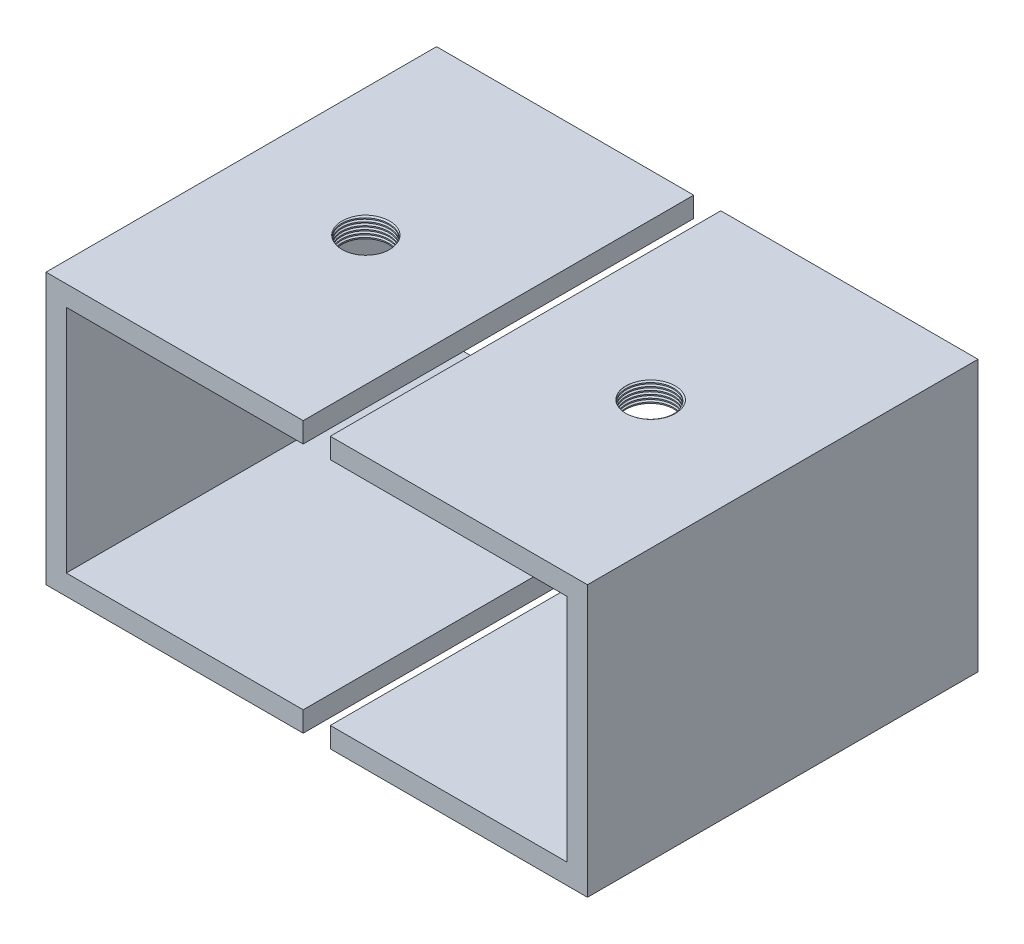
from build123d import *

# Parameters (mm, degrees)
BOSS_EXTRUDE1_DEPTH   = 288.5
BOSS_EXTRUDE1_2_DEPTH = 288.5
SKETCH2_R             = 17.5
CUT_EXTRUDE1_DEPTH    = 24
CUT_SWEEP1_PITCH      = 2.5


with BuildPart() as part:
    # Sketch1 → Boss-Extrude1 (new body)
    with BuildSketch(Plane.XY):
        Polygon((-199.740952381, -100.12952381), (-9.740952381, -100.12952381), (-9.740952381, -85.12952381), (-184.740952381, -85.12952381), (-184.740952381, 84.87047619), (-9.740952381, 84.87047619), (-9.740952381, 99.87047619), (-199.740952381, 99.87047619), align=None)
    extrude(amount=BOSS_EXTRUDE1_DEPTH)


with BuildPart() as body_2:
    # Sketch1 → Boss-Extrude1 2 (new body)
    with BuildSketch(Plane.XY):
        Polygon((10.259047619, -85.12952381), (10.259047619, -100.12952381), (200.259047619, -100.12952381), (200.259047619, 99.87047619), (10.259047619, 99.87047619), (10.259047619, 84.87047619), (185.259047619, 84.87047619), (185.259047619, -85.12952381), align=None)
    extrude(amount=BOSS_EXTRUDE1_2_DEPTH)


with BuildPart() as cut_extrude1_tool:
    # Sketch2 → Cut-Extrude1 (new body)
    with BuildSketch(Plane(origin=(0, 99.87047619, 0), x_dir=(1, 0, 0), z_dir=(0, 1, 0))):
        with Locations(Location((-104.740952381, -147.219115945, 0), (0, 0, 270))):
            Circle(SKETCH2_R)
        with Locations(Location((104.740952381, -147.219115945, 0), (0, 0, 90))):
            Circle(SKETCH2_R)
    cut_extrude1 = extrude(amount=-CUT_EXTRUDE1_DEPTH)


with BuildPart() as part_1:
    add(part.part)

    # Cut-Extrude1: cut by cut_extrude1_tool
    add(cut_extrude1_tool.part, mode=Mode.SUBTRACT)

    # Cut-Sweep1: arcs per turn and ends read off the stored shape
    # Cut-Sweep1: the profile of Sketch4 screwed along a right-hand helix through 7.6 turns, 10 arcs to a turn; built about Z, then put on its axis
    cut_sweep1_z = Axis((0, 0, 0), (0, 0, 1))
    cut_sweep1_corners = [(16.765090832, -0.0274724, -1.291700734), (18.914142879, -0.000730656, -2.467864065), (16.820766289, 0.028203056, -3.7404352)]
    with BuildLine(mode=Mode.PRIVATE) as cut_sweep1_profile:
        Line(cut_sweep1_corners[0], cut_sweep1_corners[1])
        Line(cut_sweep1_corners[1], cut_sweep1_corners[2])
        Line(cut_sweep1_corners[2], cut_sweep1_corners[0])
    cut_sweep1_cap = Face(cut_sweep1_profile.wire())
    cut_sweep1_turn_angles = [0, 18, 36, 54, 72, 90, 108, 126, 144, 162, 180, 198, 216, 234, 252, 270, 288, 306, 324, 342, 360]
    cut_sweep1_turn_weights = [1, 0.9510565162951535, 1, 0.9510565162951535, 1, 0.9510565162951535, 1, 0.9510565162951535, 1, 0.9510565162951535, 1, 0.9510565162951535, 1, 0.9510565162951535, 1, 0.9510565162951535, 1, 0.9510565162951535, 1, 0.9510565162951535, 1]
    cut_sweep1_turn_rails = [Edge.make_bspline([Vector(p[0], p[1], 0).rotate(cut_sweep1_z, cut_sweep1_turn_angles[k]) / cut_sweep1_turn_weights[k] + Vector(0, 0, p[2] + CUT_SWEEP1_PITCH * cut_sweep1_turn_angles[k] / 360) for k in range(21)], [0, 0, 0, 1, 1, 2, 2, 3, 3, 4, 4, 5, 5, 6, 6, 7, 7, 8, 8, 9, 9, 10, 10, 10], 2, cut_sweep1_turn_weights) for p in cut_sweep1_corners]
    cut_sweep1_turn_sides = [Face.make_surface_from_curves(cut_sweep1_turn_rails[p[0]], cut_sweep1_turn_rails[p[1]]) for p in [(0, 1), (1, 2), (2, 0)]]
    cut_sweep1_last_angles = [2520, 2538, 2556, 2574, 2592, 2610, 2628, 2646, 2664, 2682, 2700, 2718, 2736]
    cut_sweep1_last_weights = [1, 0.9510565162951535, 1, 0.9510565162951535, 1, 0.9510565162951535, 1, 0.9510565162951535, 1, 0.9510565162951535, 1, 0.9510565162951535, 1]
    cut_sweep1_last_rails = [Edge.make_bspline([Vector(p[0], p[1], 0).rotate(cut_sweep1_z, cut_sweep1_last_angles[k]) / cut_sweep1_last_weights[k] + Vector(0, 0, p[2] + CUT_SWEEP1_PITCH * cut_sweep1_last_angles[k] / 360) for k in range(13)], [0, 0, 0, 1, 1, 2, 2, 3, 3, 4, 4, 5, 5, 6, 6, 6], 2, cut_sweep1_last_weights) for p in cut_sweep1_corners]
    cut_sweep1_last_sides = [Face.make_surface_from_curves(cut_sweep1_last_rails[p[0]], cut_sweep1_last_rails[p[1]]) for p in [(0, 1), (1, 2), (2, 0)]]
    cut_sweep1 = Plane(origin=(-104.740952381, 99.87047619, 147.219115945), x_dir=(-0.7071067811865543, 0, -0.7071067811865408), z_dir=(0, -1, 0)) * Solid(Shell([*[p.moved(Location((0, 0, CUT_SWEEP1_PITCH * i))) for i in range(7) for p in cut_sweep1_turn_sides], *cut_sweep1_last_sides, cut_sweep1_cap, cut_sweep1_cap.rotate(cut_sweep1_z, 2736).moved(Location((0, 0, CUT_SWEEP1_PITCH * 2736 / 360)))]))
    add(cut_sweep1, mode=Mode.SUBTRACT)


with BuildPart() as body_2_1:
    add(body_2.part)

    # Cut-Extrude1: cut by cut_extrude1_tool
    add(cut_extrude1_tool.part, mode=Mode.SUBTRACT)

    # Mirror4: Cut-Extrude1, Cut-Sweep1 across plane
    add(cut_extrude1.mirror(Plane(origin=(0, 0, 0), x_dir=(0, 0, 1), z_dir=(1, 0, 0))), mode=Mode.SUBTRACT)
    add(cut_sweep1.mirror(Plane(origin=(0, 0, 0), x_dir=(0, 0, 1), z_dir=(1, 0, 0))), mode=Mode.SUBTRACT)


solid = Compound([part_1.part, body_2_1.part])
